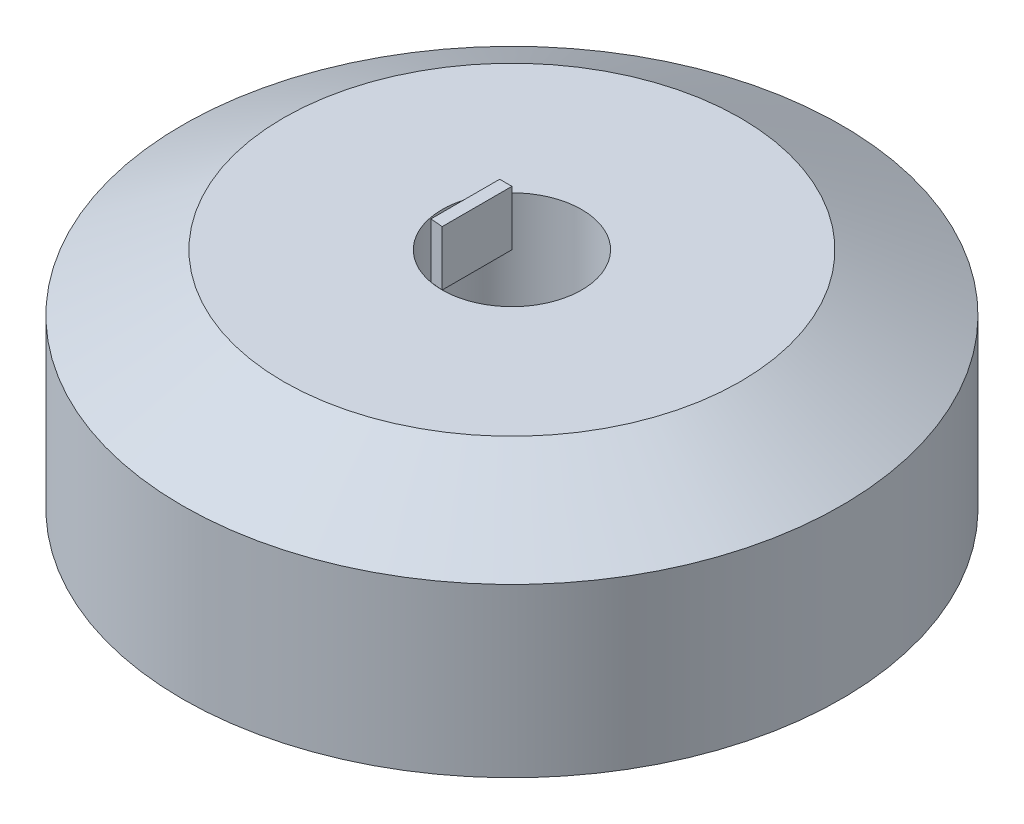
from build123d import *

# Parameters (mm, degrees)
SKETCH1_R               = 12.0015
BOSS_EXTRUDE1_DEPTH     = 5.1181
CUT_EXTRUDE1_DEPTH      = 20.820489271
CUT_EXTRUDE1_DEPTH_BACK = 20.820489271
SKETCH2_R               = 2.54
CHAMFER4_SIZE           = 3.683
CHAMFER4_SIZE2          = 2.0701
BOSS_EXTRUDE2_DEPTH     = 2


with BuildPart() as part:
    # Sketch1 → Boss-Extrude1 (new, symmetric)
    with BuildSketch(Plane(origin=(0, 0, 0), x_dir=(1, 0, 0), z_dir=(0, 1, 0))):
        with Locations(Location((0, 0, 0), (0, 0, 270))):
            Circle(SKETCH1_R)
    extrude(amount=BOSS_EXTRUDE1_DEPTH, both=True)

    # Sketch2 → Cut-Extrude1 (cut, two sides: drawn at the far end of the back side and taken through both)
    with BuildSketch(Plane.XZ.offset(5.1181).offset(-CUT_EXTRUDE1_DEPTH_BACK)):
        with Locations(Location((0, 0, 0), (0, 0, 270))):
            Circle(SKETCH2_R)
    extrude(amount=CUT_EXTRUDE1_DEPTH + CUT_EXTRUDE1_DEPTH_BACK, mode=Mode.SUBTRACT)

    # Chamfer2: read off the stored shape, not the designer's step
    # Chamfer2 outline → Chamfer2 (revolve, cut)
    with BuildSketch(Plane.XY):
        Polygon((12.0015, 5.1181), (8.3185, 5.1181), (12.0015, 3.048), align=None)
    revolve(axis=Axis((0, 0, 0), (0, 1, 0)), mode=Mode.SUBTRACT)

    # Chamfer4
    chamfer4_edges = [part.edges().sort_by_distance(p)[0] for p in [
        (0, -5.1181, -12.0015),
    ]]
    chamfer4_side = [part.faces().sort_by_distance(p)[0] for p in [
        (0, -5.1181, -11.662046319),
    ]]
    chamfer(chamfer4_edges, length=CHAMFER4_SIZE, length2=CHAMFER4_SIZE2, reference=chamfer4_side[0])


with BuildPart() as body_2:
    # Sketch4 → Boss-Extrude2 (new body)
    with BuildSketch(Plane(origin=(0, 5.1181, 0), x_dir=(1, 0, 0), z_dir=(0, 1, 0))):
        Polygon((0, 0), (-0.446980105, 0), (-0.446980105, -2.500361731), (0, -2.54), align=None)
    extrude(amount=BOSS_EXTRUDE2_DEPTH)


solid = Compound([part.part, body_2.part])
